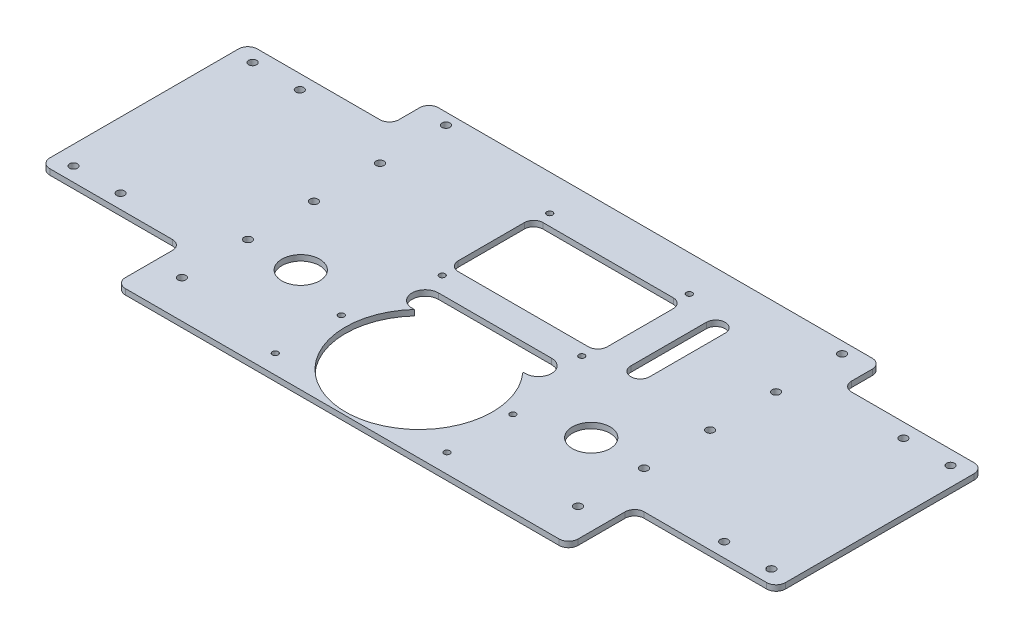
from build123d import *

# Parameters (mm, degrees)
SKETCH_1_W          = 240
SKETCH_1_H          = 166
EXTRUDE_1260_DEPTH  = 3
SKETCH_4_R          = 2.1
SKETCH_4_R_2        = 1.55
CUT_EXTRUDE_3_DEPTH = 251.068459046
SKETCH_5_R          = 1.55
SKETCH_5_R_2        = 10
SKETCH_5_W          = 79
SKETCH_5_H          = 45
CUT_EXTRUDE_4_DEPTH = 251.068459046
SKETCH_6_W          = 75
SKETCH_6_H          = 110
SKETCH_6_R          = 2.1
EXTRUDE_1_DEPTH     = 3
FILLET_1_R          = 5
SKETCH_8_R          = 39
CUT_EXTRUDE_6_DEPTH = 10


with BuildPart() as part:
    # 草图1 → Extrude 1260 (new body)
    with BuildSketch(Plane(origin=(0, 0, 0), x_dir=(1, 0, 0), z_dir=(0, 1, 0))):
        with Locations((31.575924772, -115.871750732)):
            Rectangle(SKETCH_1_W, SKETCH_1_H)
    extrude(amount=EXTRUDE_1260_DEPTH)

    # 草图4 → 切除-拉伸3 (cut, through all)
    with BuildSketch(Plane(origin=(0, 3, 0), x_dir=(1, 0, 0), z_dir=(0, 1, 0))):
        with Locations((-73.424075228, -73.871750732)):
            Circle(SKETCH_4_R)
        with Locations((136.575924772, -178.871750732)):
            Circle(SKETCH_4_R)
        with Locations((-73.424075228, -108.871750732)):
            Circle(SKETCH_4_R)
        with Locations((-73.424075228, -143.871750732)):
            Circle(SKETCH_4_R)
        with Locations((-73.424075228, -178.871750732)):
            Circle(SKETCH_4_R)
        with Locations((136.575924772, -143.871750732)):
            Circle(SKETCH_4_R)
        with Locations((136.575924772, -108.871750732)):
            Circle(SKETCH_4_R)
        with Locations((136.575924772, -73.871750732)):
            Circle(SKETCH_4_R)
        with Locations((-73.424075228, -38.871750732)):
            Circle(SKETCH_4_R)
        with Locations((136.575924772, -38.871750732)):
            Circle(SKETCH_4_R)
        with Locations((77.075924772, -188.871750732)):
            Circle(SKETCH_4_R_2)
        with Locations((-13.924075228, -188.871750732)):
            Circle(SKETCH_4_R_2)
        with Locations((77.075924772, -153.871750732)):
            Circle(SKETCH_4_R_2)
        with Locations((-13.924075228, -153.871750732)):
            Circle(SKETCH_4_R_2)
    extrude(amount=-CUT_EXTRUDE_3_DEPTH, mode=Mode.SUBTRACT)

    # 草图5 → 切除-拉伸4 (cut, through all)
    with BuildSketch(Plane(origin=(0, 3, 0), x_dir=(1, 0, 0), z_dir=(0, 1, 0))):
        with Locations((-5.424075228, -51.871750732)):
            Circle(SKETCH_5_R)
        with Locations((68.575924772, -51.871750732)):
            Circle(SKETCH_5_R)
        with Locations((68.575924772, -108.871750732)):
            Circle(SKETCH_5_R)
        with Locations((-5.424075228, -108.871750732)):
            Circle(SKETCH_5_R)
        with Locations((-45.424075228, -143.871750732)):
            Circle(SKETCH_5_R_2)
        with Locations((108.575924772, -143.871750732)):
            Circle(SKETCH_5_R_2)
        with Locations((31.575924772, -80.371750732)):
            Rectangle(SKETCH_5_W, SKETCH_5_H)
        with BuildLine():
            Line((86.075924772, -100.371750732), (86.075924772, -60.371750732))
            ThreePointArc((86.075924772, -60.371750732), (91.075924772, -55.371750732), (96.075924772, -60.371750732))
            Line((96.075924772, -60.371750732), (96.075924772, -100.371750732))
            ThreePointArc((96.075924772, -100.371750732), (91.075924772, -105.371750732), (86.075924772, -100.371750732))
        make_face()
        with BuildLine():
            Line((1.575924772, -117.871750732), (61.575924772, -117.871750732))
            ThreePointArc((61.575924772, -117.871750732), (68.575924772, -124.871750732), (61.575924772, -131.871750732))
            Line((61.575924772, -131.871750732), (41.575924772, -131.871750732))
            ThreePointArc((41.575924772, -131.871750732), (31.575924772, -141.871750732), (21.575924772, -131.871750732))
            Line((21.575924772, -131.871750732), (1.575924772, -131.871750732))
            ThreePointArc((1.575924772, -131.871750732), (-5.424075228, -124.871750732), (1.575924772, -117.871750732))
        make_face()
    extrude(amount=-CUT_EXTRUDE_4_DEPTH, mode=Mode.SUBTRACT)

    # 草图6 → 凸台-拉伸1 (add)
    # profile 1 of 2: a face of its own
    with BuildSketch(Plane(origin=(0, 0, 0), x_dir=(1, 0, 0), z_dir=(0, 1, 0))):
        with Locations((-125.924075228, -108.871750732)):
            Rectangle(SKETCH_6_W, SKETCH_6_H)
        with Locations((-153.424075228, -61.371750732)):
            Circle(SKETCH_6_R, mode=Mode.SUBTRACT)
        with Locations((-153.424075228, -156.371750732)):
            Circle(SKETCH_6_R, mode=Mode.SUBTRACT)
        with Locations((-128.424075228, -61.371750732)):
            Circle(SKETCH_6_R, mode=Mode.SUBTRACT)
        with Locations((-128.424075228, -156.371750732)):
            Circle(SKETCH_6_R, mode=Mode.SUBTRACT)
    # profile 2 of 2: a face of its own
    with BuildSketch(Plane(origin=(0, 0, 0), x_dir=(1, 0, 0), z_dir=(0, 1, 0))):
        with Locations((189.075924772, -108.871750732)):
            Rectangle(SKETCH_6_W, SKETCH_6_H)
        with Locations((216.575924772, -156.371750732)):
            Circle(SKETCH_6_R, mode=Mode.SUBTRACT)
        with Locations((216.575924772, -61.371750732)):
            Circle(SKETCH_6_R, mode=Mode.SUBTRACT)
        with Locations((191.575924772, -156.371750732)):
            Circle(SKETCH_6_R, mode=Mode.SUBTRACT)
        with Locations((191.575924772, -61.371750732)):
            Circle(SKETCH_6_R, mode=Mode.SUBTRACT)
    extrude(amount=EXTRUDE_1_DEPTH)

    # 圆角1
    fillet_1_edges = [part.edges().sort_by_distance(p)[0] for p in [
        (71.075924772, 1.5, 102.871750732),
        (-7.924075228, 1.5, 102.871750732),
        (-7.924075228, 1.5, 57.871750732),
        (71.075924772, 1.5, 57.871750732),
        (151.575924772, 1.5, 32.871750732),
        (-88.424075228, 1.5, 32.871750732),
        (151.575924772, 1.5, 53.871750732),
        (151.575924772, 1.5, 163.871750732),
        (-88.424075228, 1.5, 163.871750732),
        (-88.424075228, 1.5, 53.871750732),
        (226.575924772, 1.5, 53.871750732),
        (226.575924772, 1.5, 163.871750732),
        (151.575924772, 1.5, 198.871750732),
        (-88.424075228, 1.5, 198.871750732),
        (-163.424075228, 1.5, 53.871750732),
        (-163.424075228, 1.5, 163.871750732),
        (41.575924772, 1.5, 131.871750732),
        (21.575924772, 1.5, 131.871750732),
    ]]
    fillet(fillet_1_edges, radius=FILLET_1_R)

    # 草图8 → 切除-拉伸6 (cut)
    with BuildSketch(Plane(origin=(0, 3, 0), x_dir=(1, 0, 0), z_dir=(0, 1, 0))):
        with Locations((31.575924772, -158.205226673)):
            Circle(SKETCH_8_R)
    extrude(amount=-CUT_EXTRUDE_6_DEPTH, mode=Mode.SUBTRACT)


solid = part.part
